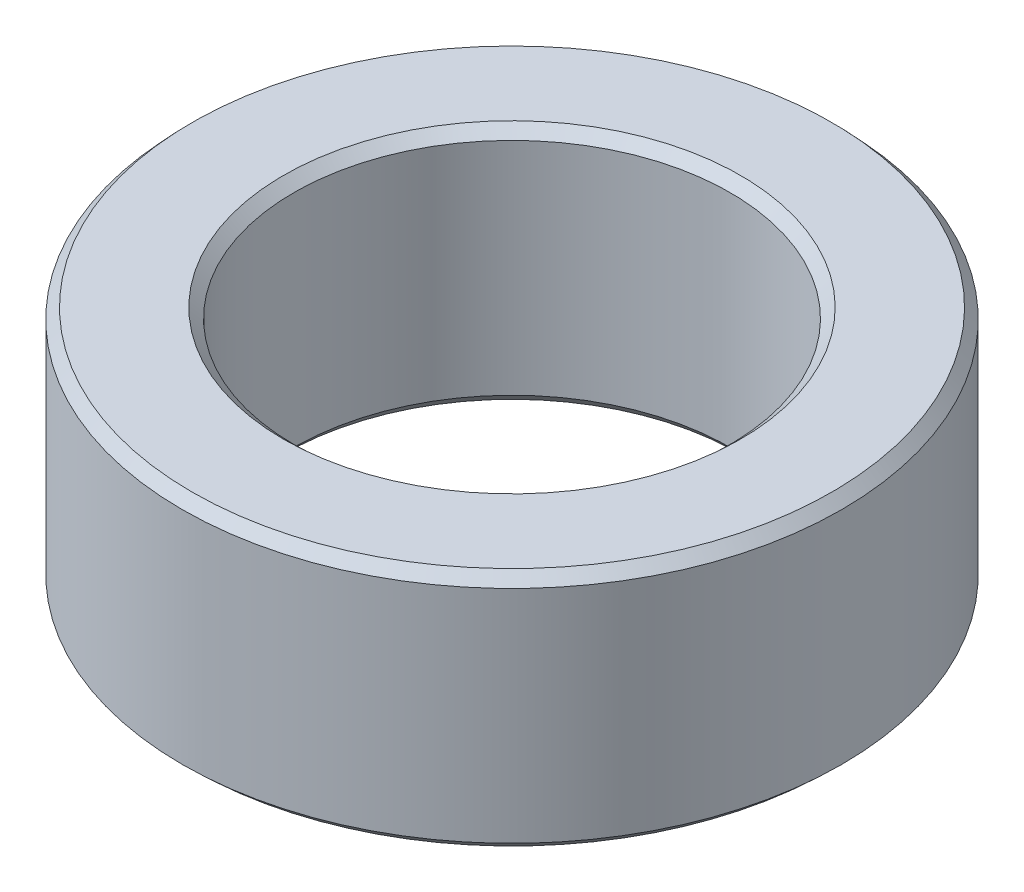
from build123d import *
from OCP.BRepFilletAPI import BRepFilletAPI_MakeChamfer

# Parameters (mm, degrees)
SKETCH1_R           = 55
BOSS_EXTRUDE1_DEPTH = 40.169534625
SKETCH2_R           = 36.389803577
CUT_EXTRUDE1_DEPTH  = 88.541941445
CHAMFER1_SIZE       = 1.732965805
CHAMFER1_SIZE2      = 1.616839634


with BuildPart() as part:
    # Sketch1 → Boss-Extrude1 (new body)
    with BuildSketch(Plane(origin=(0, 0, 0), x_dir=(1, 0, 0), z_dir=(0, 1, 0))):
        Circle(SKETCH1_R)
    extrude(amount=BOSS_EXTRUDE1_DEPTH)

    # Sketch2 → Cut-Extrude1 (cut, through all)
    with BuildSketch(Plane(origin=(0, 0, 0), x_dir=(1, 0, 0), z_dir=(0, 1, 0))):
        Circle(SKETCH2_R)
    extrude(amount=CUT_EXTRUDE1_DEPTH, mode=Mode.SUBTRACT)

    # Chamfer1: one chamfer whose edges measure the first distance from different faces: ONE call of the kernel's chamfer builder (chamfer() names one face for all edges)
    chamfer1_edges_1 = [part.edges().sort_by_distance(p)[0] for p in [
        (-36.389803577, 40.169534625, 0),
    ]]
    chamfer1_side_1 = [part.faces().sort_by_distance(p)[0] for p in [
        (-53.444365081, 40.169534625, 0),
    ]]
    chamfer1_edges_2 = [part.edges().sort_by_distance(p)[0] for p in [
        (-36.389803577, 0, 0),
    ]]
    chamfer1_side_2 = [part.faces().sort_by_distance(p)[0] for p in [
        (-36.389803577, 20.084767312, 0),
    ]]
    chamfer1_edges_3 = [part.edges().sort_by_distance(p)[0] for p in [
        (-55, 0, 0),
    ]]
    chamfer1_side_3 = [part.faces().sort_by_distance(p)[0] for p in [
        (-53.444365081, 0, 0),
    ]]
    chamfer1_edges_4 = [part.edges().sort_by_distance(p)[0] for p in [
        (-55, 40.169534625, 0),
    ]]
    chamfer1_side_4 = [part.faces().sort_by_distance(p)[0] for p in [
        (-55, 20.084767312, 0),
    ]]
    chamfer1 = BRepFilletAPI_MakeChamfer(part.part.solid().wrapped)
    for e in chamfer1_edges_1:
        chamfer1.Add(CHAMFER1_SIZE, CHAMFER1_SIZE2, e.wrapped, chamfer1_side_1[0].wrapped)  # the first distance lies on this face
    for e in chamfer1_edges_2:
        chamfer1.Add(CHAMFER1_SIZE, CHAMFER1_SIZE2, e.wrapped, chamfer1_side_2[0].wrapped)  # the first distance lies on this face
    for e in chamfer1_edges_3:
        chamfer1.Add(CHAMFER1_SIZE, CHAMFER1_SIZE2, e.wrapped, chamfer1_side_3[0].wrapped)  # the first distance lies on this face
    for e in chamfer1_edges_4:
        chamfer1.Add(CHAMFER1_SIZE, CHAMFER1_SIZE2, e.wrapped, chamfer1_side_4[0].wrapped)  # the first distance lies on this face
    add(Compound.cast(chamfer1.Shape()), mode=Mode.REPLACE)


solid = part.part
